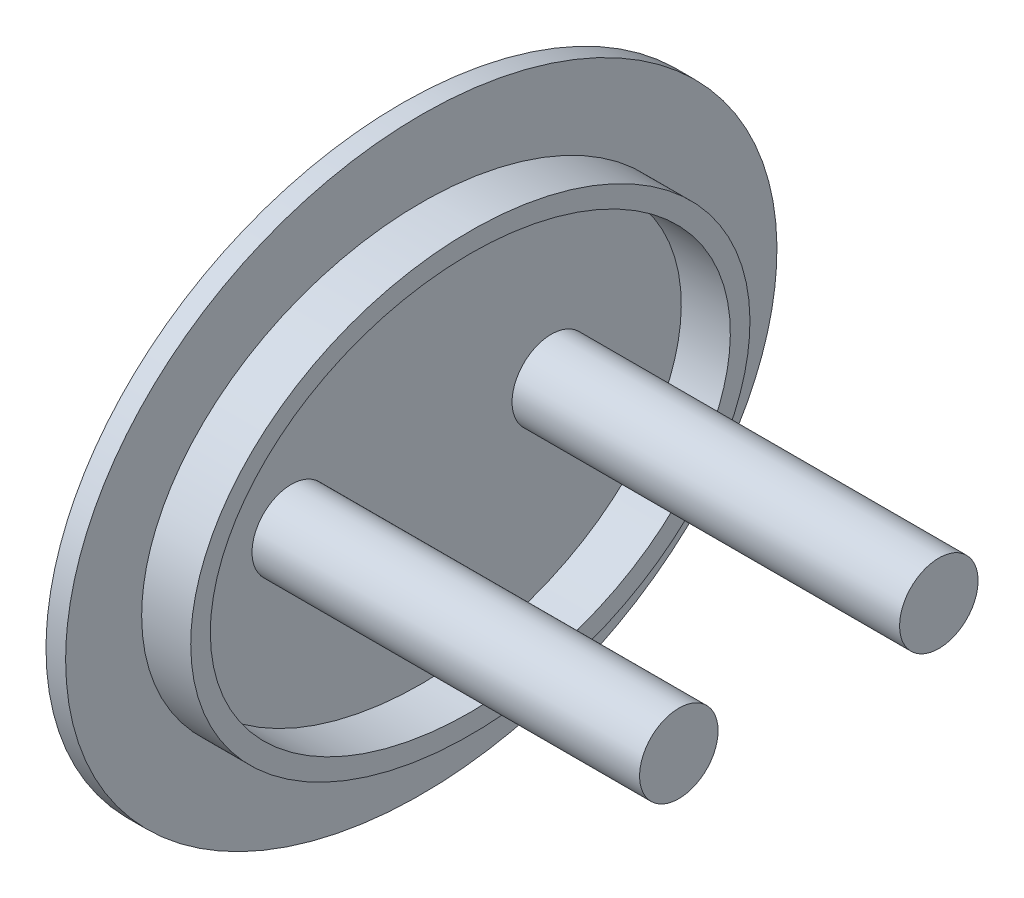
from build123d import *

# Parameters (mm, degrees)
CROQUIS1_RX             = 72.5
CROQUIS1_RY             = 60
SALIENTE_EXTRUIR1_DEPTH = 4
SALIENTE_EXTRUIR2_DEPTH = 10
CROQUIS3_R              = 8
SALIENTE_EXTRUIR3_DEPTH = 79


# Read off the part's stored shape, not the designer's step: Saliente-Extruir2
with BuildPart() as part:
    # Croquis1 → Saliente-Extruir1 (new body)
    with BuildSketch(Plane(origin=(0, 0, 0), x_dir=(0, 0, -1), z_dir=(1, 0, 0))):
        with Locations(Location((0, 0), (0, 0, 180))):
            Ellipse(CROQUIS1_RX, CROQUIS1_RY)
    extrude(amount=SALIENTE_EXTRUIR1_DEPTH)

    # Saliente-Extruir2 outline → Saliente-Extruir2 (add)
    with BuildSketch(Plane(origin=(4, 0, 0), x_dir=(0, 0, -1), z_dir=(1, 0, 0))):
        with BuildLine():
            add(Edge.make_bspline(
                [(-57, 0), (-57, -77.076260937), (28.5, -38.538130468), (114, 0), (28.5, 38.538130468), (-57, 77.076260937), (-57, 0)],
                knots=[0, 0, 0, 2.094395102, 2.094395102, 4.188790205, 4.188790205, 6.283185307, 6.283185307, 6.283185307], degree=2, weights=[1, 0.5, 1, 0.5, 1, 0.5, 1]))
        make_face()
        with BuildLine():
            add(Edge.make_bspline(
                [(-53, 0), (-53, -5.158593756), (-50.396647476, -15.475781269), (-38.877748785, -29.024942223), (-21.15386092, -38.304344888), (0, -41.597827556), (21.15386092, -38.304344888), (38.877748785, -29.024942223), (50.396647476, -15.475781269), (54.301676262, 0), (50.396647476, 15.475781269), (38.877748785, 29.024942223), (21.15386092, 38.304344888), (0, 41.597827556), (-21.15386092, 38.304344888), (-38.877748785, 29.024942223), (-50.396647476, 15.475781269), (-53, 5.158593756), (-53, 0)],
                knots=[0, 0, 0, 0, 0.392699082, 0.785398163, 1.178097245, 1.570796327, 1.963495408, 2.35619449, 2.748893572, 3.141592654, 3.534291735, 3.926990817, 4.319689899, 4.71238898, 5.105088062, 5.497787144, 5.890486225, 6.283185307, 6.283185307, 6.283185307, 6.283185307], degree=3))
        make_face(mode=Mode.SUBTRACT)
    extrude(amount=SALIENTE_EXTRUIR2_DEPTH)

    # Croquis3 → Saliente-Extruir3 (add)
    with BuildSketch(Plane(origin=(4, 0, 0), x_dir=(0, 0, -1), z_dir=(1, 0, 0))):
        with Locations((-26.5, 0)):
            Circle(CROQUIS3_R)
        with Locations(Location((26.5, 0, 0), (0, 0, 180))):
            Circle(CROQUIS3_R)
    extrude(amount=SALIENTE_EXTRUIR3_DEPTH)


solid = part.part
